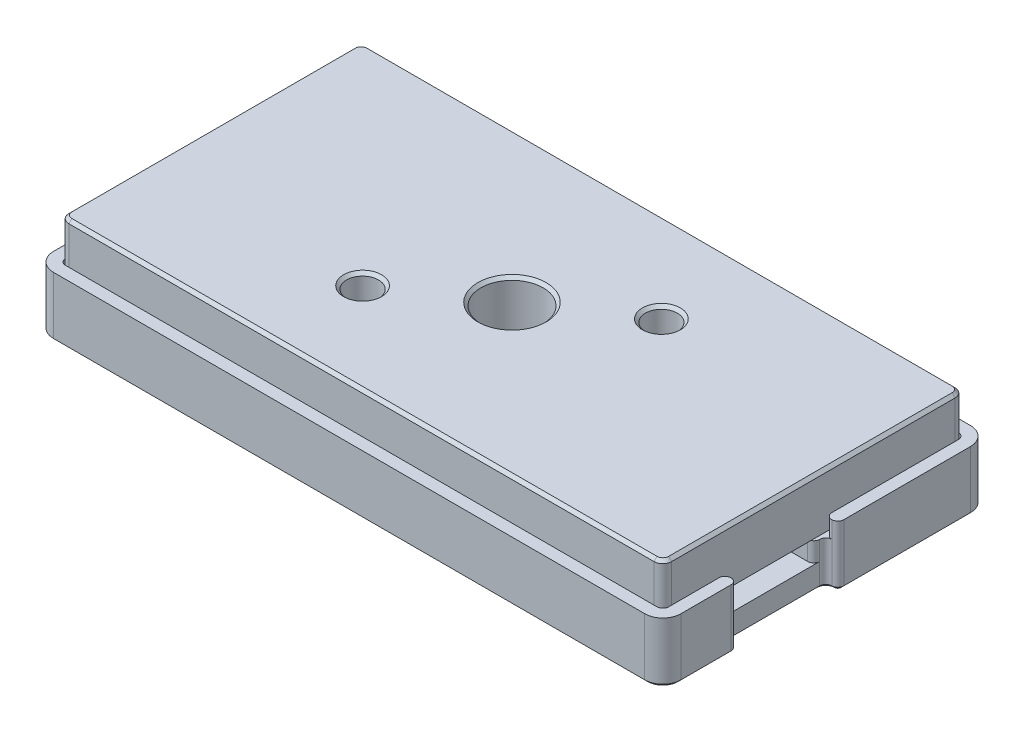
from build123d import *

# Parameters (mm, degrees)
BOSS_EXTRUDE1_DEPTH                 = 3.175
BOSS_EXTRUDE1_2_DEPTH               = 3.175
BOSS_EXTRUDE2_START                 = 3.175
SKETCH1_3_W                         = 100
SKETCH1_3_H                         = 50
SKETCH1_3_R                         = 5.159375
BOSS_EXTRUDE2_DEPTH                 = 9.525
SKETCH1_5_W                         = 100
SKETCH1_5_H                         = 50
SKETCH1_5_R                         = 2.38125
BOSS_EXTRUDE3_DEPTH                 = 4
F_7_6_7_6_DIAMETER_HOLE1_AT_2_COUNT = 2
F_7_6_7_6_DIAMETER_HOLE1_AT_2_PITCH = 35.661262246
SKETCH9_W                           = 2.65
SKETCH9_H                           = 9.525
M5_CLEARANCE_HOLE1_AT_2_COUNT       = 2
M5_CLEARANCE_HOLE1_AT_2_PITCH       = 35.661262246
BOSS_EXTRUDE4_DEPTH                 = 10
CUT_EXTRUDE1_DEPTH                  = 3.175
FILLET1_R                           = 1.5
FILLET2_R                           = 1
FILLET3_R                           = 3
FILLET4_R                           = 1.5
FILLET5_R                           = 1
CUT_EXTRUDE2_START                  = -9.525
CUT_EXTRUDE2_DEPTH                  = 9.525
CHAMFER1_SIZE                       = 0.5
CHAMFER2_SIZE                       = 0.5


# Read off the part's stored shape, not the designer's step: Cut-Extrude2
with BuildPart() as part:
    # Sketch1 → Boss-Extrude1 (new body)
    with BuildSketch(Plane(origin=(0, 0, 0), x_dir=(1, 0, 0), z_dir=(0, 1, 0))):
        Polygon((4.7625, 0), (50, 0), (50, 25), (-50, 25), (-50, 12.7), (4.7625, 12.7), align=None)
    extrude(amount=BOSS_EXTRUDE1_DEPTH)



with BuildPart() as body_2:
    # Sketch1 → Boss-Extrude1 2 (new body)
    with BuildSketch(Plane(origin=(0, 0, 0), x_dir=(1, 0, 0), z_dir=(0, 1, 0))):
        Polygon((-4.7625, 0), (-50, 0), (-50, -25), (50, -25), (50, -12.7), (-4.7625, -12.7), align=None)
    extrude(amount=BOSS_EXTRUDE1_2_DEPTH)


with BuildPart() as body_3:
    # Sketch1<3> → Boss-Extrude2 (new body)
    with BuildSketch(Plane(origin=(0, 0, 0), x_dir=(1, 0, 0), z_dir=(0, 1, 0)).offset(BOSS_EXTRUDE2_START)):
        Rectangle(SKETCH1_3_W, SKETCH1_3_H)
        with Locations(Location((0, 0, 0), (0, 0, 90))):
            Circle(SKETCH1_3_R, mode=Mode.SUBTRACT)
    extrude(amount=BOSS_EXTRUDE2_DEPTH)

    # Sketch9 → M5 Clearance Hole1 (revolve, cut)
    with BuildSketch(Plane(origin=(14.7625, 12.7, -10), x_dir=(0, 0, 1), z_dir=(1, 0, 0))):
        with Locations((1.325, 4.7625)):
            Rectangle(SKETCH9_W, SKETCH9_H)
    m5_clearance_hole1 = revolve(axis=Axis((14.7625, 19.05, -10), (0, -1, 0)), mode=Mode.SUBTRACT)

    # M5 Clearance Hole1 at 2: M5 Clearance Hole1 ×2
    with Locations(*[Vector(-0.8279291909544274, 0, 0.5608326441689601) * (i * M5_CLEARANCE_HOLE1_AT_2_PITCH) for i in range(1, M5_CLEARANCE_HOLE1_AT_2_COUNT)]):
        add(m5_clearance_hole1, mode=Mode.SUBTRACT)

    # Fillet1
    fillet1_edges = [body_3.edges().sort_by_distance(p)[0] for p in [
        (50, 7.9375, 25),
        (50, 7.9375, -25),
        (-50, 7.9375, -25),
        (-50, 7.9375, 25),
    ]]
    fillet(fillet1_edges, radius=FILLET1_R)

    # Cut-Extrude2 outline → Cut-Extrude2 (cut)
    with BuildSketch(Plane(origin=(0, 12.7, 0), x_dir=(1, 0, 0), z_dir=(0, 1, 0)).offset(CUT_EXTRUDE2_START)):
        with BuildLine():
            ThreePointArc((-50, -23.5), (-49.560660172, -24.560660172), (-48.5, -25))
            Line((-48.5, -25), (48.5, -25))
            ThreePointArc((48.5, -25), (49.560660172, -24.560660172), (50, -23.5))
            Line((50, -23.5), (50, 23.5))
            ThreePointArc((50, 23.5), (49.560660172, 24.560660172), (48.5, 25))
            Line((48.5, 25), (-48.5, 25))
            ThreePointArc((-48.5, 25), (-49.560660172, 24.560660172), (-50, 23.5))
            Line((-50, 23.5), (-50, -23.5))
        make_face()
        with BuildLine():
            ThreePointArc((48.5, 24.95), (49.525304833, 24.525304833), (49.95, 23.5))
            Line((49.95, 23.5), (49.95, -23.5))
            ThreePointArc((49.95, -23.5), (49.525304833, -24.525304833), (48.5, -24.95))
            Line((48.5, -24.95), (-48.5, -24.95))
            ThreePointArc((-48.5, -24.95), (-49.525304833, -24.525304833), (-49.95, -23.5))
            Line((-49.95, -23.5), (-49.95, 23.5))
            ThreePointArc((-49.95, 23.5), (-49.525304833, 24.525304833), (-48.5, 24.95))
            Line((-48.5, 24.95), (48.5, 24.95))
        make_face(mode=Mode.SUBTRACT)
    extrude(amount=CUT_EXTRUDE2_DEPTH, mode=Mode.SUBTRACT)

    # Chamfer2
    chamfer2_edges = [body_3.edges().sort_by_distance(p)[0] for p in [
        (49.525304833, 12.7, -24.525304833),
        (0, 12.7, -24.95),
        (-49.525304833, 12.7, -24.525304833),
        (-49.95, 12.7, 0),
        (-49.525304833, 12.7, 24.525304833),
        (0, 12.7, 24.95),
        (49.525304833, 12.7, 24.525304833),
        (49.95, 12.7, 0),
        (49.95, 3.175, 0),
        (49.525304833, 3.175, -24.525304833),
        (0, 3.175, -24.95),
        (-49.525304833, 3.175, -24.525304833),
        (-49.95, 3.175, 0),
        (-49.525304833, 3.175, 24.525304833),
        (0, 3.175, 24.95),
        (49.525304833, 3.175, 24.525304833),
        (0, 3.175, 5.159375),
        (0, 12.7, 5.159375),
        (-14.7625, 12.7, 7.35),
        (-14.7625, 3.175, 7.35),
        (14.7625, 12.7, -12.65),
        (14.7625, 3.175, -12.65),
    ]]
    chamfer(chamfer2_edges, length=CHAMFER2_SIZE)


with BuildPart() as part_1:
    add(part.part)

    add(body_2.part)  # Boss-Extrude3 merges body 2
    # Sketch1<5> → Boss-Extrude3 (add)
    with BuildSketch(Plane(origin=(0, 0, 0), x_dir=(1, 0, 0), z_dir=(0, 1, 0))):
        Rectangle(SKETCH1_5_W, SKETCH1_5_H)
        with Locations(Location((0, 0, 0), (0, 0, 270))):
            Circle(SKETCH1_5_R, mode=Mode.SUBTRACT)
    extrude(amount=-BOSS_EXTRUDE3_DEPTH)

    # Sketch7 → Ø7.6 (7.6) Diameter Hole1 (revolve, cut)
    with BuildSketch(Plane(origin=(-14.7625, -4, 10), x_dir=(0, 0, -1), z_dir=(1, 0, 0))):
        Polygon((0, 0), (0, 16.7), (3.8, 16.7), (3.8, 0.55), (4.35, 0), align=None)
    f_7_6_7_6_diameter_hole1 = revolve(axis=Axis((-14.7625, -10.35, 10), (0, 1, 0)), mode=Mode.SUBTRACT)

    # Ø7.6 (7.6) Diameter Hole1 at 2: Ø7.6 (7.6) Diameter Hole1 ×2
    with Locations(*[Vector(0.8279291909544274, 0, -0.5608326441689601) * (i * F_7_6_7_6_DIAMETER_HOLE1_AT_2_PITCH) for i in range(1, F_7_6_7_6_DIAMETER_HOLE1_AT_2_COUNT)]):
        add(f_7_6_7_6_diameter_hole1, mode=Mode.SUBTRACT)

    # Sketch10 → Boss-Extrude4 (add)
    with BuildSketch(Plane.XZ.offset(4)):
        Polygon((52, 14.7), (52, 27), (-52, 27), (-52, 2), (-50, 2), (-50, 25), (50, 25), (50, 14.7), align=None)
        Polygon((52, -27), (52, -2), (50, -2), (50, -25), (-50, -25), (-50, -14.7), (-52, -14.7), (-52, -27), align=None)
    extrude(amount=-BOSS_EXTRUDE4_DEPTH)

    # Sketch11 → Cut-Extrude1 (cut)
    with BuildSketch(Plane(origin=(0, 3.175, 0), x_dir=(1, 0, 0), z_dir=(0, 1, 0))):
        with BuildLine():
            Line((-2.848286438, -12.7), (-4.7625, -12.7))
            Line((-4.7625, -12.7), (-4.7625, -10.785786438))
            ThreePointArc((-4.7625, -10.785786438), (-5.323160172, -13.260660172), (-2.848286438, -12.7))
        make_face()
        with BuildLine():
            Line((-4.7625, -10.785786438), (-4.7625, -12.7))
            Line((-4.7625, -12.7), (-2.848286438, -12.7))
            ThreePointArc((-2.848286438, -12.7), (-2.784102161, -12.453652968), (-2.7625, -12.2))
            ThreePointArc((-2.7625, -12.2), (-3.396474596, -10.975255129), (-4.7625, -10.785786438))
        make_face()
        with BuildLine():
            Line((4.7625, 10.785786438), (4.7625, 12.7))
            Line((4.7625, 12.7), (2.848286438, 12.7))
            ThreePointArc((2.848286438, 12.7), (3.201839828, 11.139339828), (4.7625, 10.785786438))
        make_face()
        with BuildLine():
            Line((2.848286438, 12.7), (4.7625, 12.7))
            Line((4.7625, 12.7), (4.7625, 10.785786438))
            ThreePointArc((4.7625, 10.785786438), (5.487244871, 11.333974596), (5.7625, 12.2))
            ThreePointArc((5.7625, 12.2), (4.516152968, 13.678397839), (2.848286438, 12.7))
        make_face()
    extrude(amount=-CUT_EXTRUDE1_DEPTH, mode=Mode.SUBTRACT)

    # Fillet2
    fillet2_edges = [part_1.edges().sort_by_distance(p)[0] for p in [
        (-50, 4.5875, -25),
        (50, 4.5875, -25),
        (52, 1, -2),
        (-52, 1, -14.7),
        (-50, 1.5875, -12.7),
        (50, 1.5875, 0),
        (4.7625, 1.5875, 0),
        (-4.7625, 1.5875, 0),
        (-50, 1.5875, 0),
        (50, 1.5875, 12.7),
        (-52, 1, 2),
        (52, 1, 14.7),
        (50, 4.5875, 25),
        (-50, 4.5875, 25),
        (-50, 4.5875, -14.7),
        (50, 4.5875, -2),
        (-50, 4.5875, 2),
        (50, 4.5875, 14.7),
    ]]
    fillet(fillet2_edges, radius=FILLET2_R - 0.0001)  # a hair under: the kernel refuses the full size

    # Fillet3
    fillet3_edges = [part_1.edges().sort_by_distance(p)[0] for p in [
        (52, 1, -27),
        (-52, 1, -27),
        (-52, 1, 27),
        (52, 1, 27),
    ]]
    fillet(fillet3_edges, radius=FILLET3_R)

    # Fillet4
    fillet4_edges = [part_1.edges().sort_by_distance(p)[0] for p in [
        (-4.7625, 1.5875, 10.785786438),
        (-2.848286438, 1.5875, 12.7),
        (4.7625, 1.5875, -10.785786438),
        (2.848286438, 1.5875, -12.7),
    ]]
    fillet(fillet4_edges, radius=FILLET4_R)

    # Fillet5
    fillet5_edges = [part_1.edges().sort_by_distance(p)[0] for p in [
        (-50, -0.4125, -14.7),
        (-50, -0.4125, 2),
        (50, -0.4125, 14.7),
        (50, -0.4125, -2),
    ]]
    fillet(fillet5_edges, radius=FILLET5_R - 0.0001)  # a hair under: the kernel refuses the full size

    # Chamfer1
    chamfer1_edges = [part_1.edges().sort_by_distance(p)[0] for p in [
        (-52, -4, -19.84995),
        (52, -4, 19.84995),
        (51.707136071, -4, -2.292863929),
        (51.707136071, -4, 14.992863929),
        (-51.707136071, -4, 2.292863929),
        (-51.707136071, -4, -14.992863929),
        (0, -4, 27),
        (0, -4, -27),
        (52, -4, -13.49995),
        (-52, -4, 13.49995),
        (51.121320344, -4, 26.121320344),
        (51.121320344, -4, -26.121320344),
        (-51.121320344, -4, -26.121320344),
        (-51.121320344, -4, 26.121320344),
        (-50, -4, -6.35),
        (50, -4, 6.35),
        (-50.292863929, -4, -14.407136071),
        (-50.292863929, -4, 1.707136071),
        (50.292863929, -4, 14.407136071),
        (50.292863929, -4, -1.707136071),
    ]]
    chamfer(chamfer1_edges, length=CHAMFER1_SIZE)

    # Sketch15 → 1/4 (0.25) Diameter Hole1 (revolve, cut)
    with BuildSketch(Plane(origin=(0, -4, 0), x_dir=(0, 0, -1), z_dir=(1, 0, 0))):
        Polygon((0, 0), (0, 10), (3.175, 10), (3.175, 0.635), (3.81, 0), align=None)
    revolve(axis=Axis((0, -10.35, 0), (0, 1, 0)), mode=Mode.SUBTRACT)


solid = Compound([body_3.part, part_1.part])
